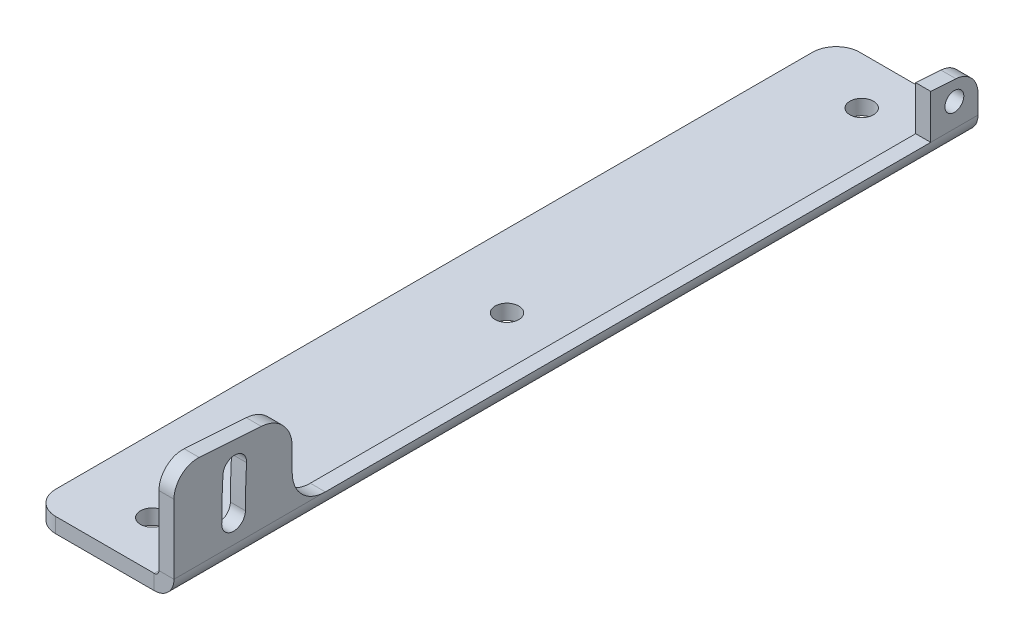
from build123d import *

# Parameters (mm, degrees)
BASE_FLANGE1_DEPTH = 170
FILLET1_R          = 5
SKETCH6_R          = 2
CUT_EXTRUDE1_DEPTH = 178.200451467
SKETCH7_R          = 2.5
CUT_EXTRUDE2_DEPTH = 178.200451467
CUT_EXTRUDE3_DEPTH = 177.690635363
FILLET2_R          = 5
CUT_EXTRUDE4_DEPTH = 175.263907966
FILLET3_R          = 7


# Sheet-metal steps are written as plain solids
with BuildPart() as part:
    # Sketch1 → Base-Flange1 (new body)
    with BuildSketch(Plane.XY):
        with BuildLine():
            Line((0, 40), (0, 4.175))
            ThreePointArc((0, 4.175), (-1.222829189, 1.222829189), (-4.175, 0))
            Line((-4.175, 0), (-30, 0))
            Line((-30, 0), (-30, 3.175))
            Line((-30, 3.175), (-4.175, 3.175))
            ThreePointArc((-4.175, 3.175), (-3.467893219, 3.467893219), (-3.175, 4.175))
            Line((-3.175, 4.175), (-3.175, 40))
            Line((-3.175, 40), (0, 40))
        make_face()
    extrude(amount=BASE_FLANGE1_DEPTH)

    # Fillet1
    fillet1_edges = [part.edges().sort_by_distance(p)[0] for p in [
        (-1.5875, 40, 170),
        (-1.5875, 40, 0),
        (-30, 1.5875, 170),
        (-30, 1.5875, 0),
    ]]
    fillet(fillet1_edges, radius=FILLET1_R)

    # Sketch6 → Cut-Extrude1 (cut, through all)
    with BuildSketch(Plane.ZY):
        with BuildLine():
            ThreePointArc((159.640076561, 18.14476706), (156.999504521, 20.49580498), (154.648466601, 17.85523294))
            ThreePointArc((154.648466601, 17.85523294), (154.837103455, 13.516938304), (154.9, 9.175))
            ThreePointArc((154.9, 9.175), (157.4, 6.675), (159.9, 9.175))
            ThreePointArc((159.9, 9.175), (159.835005505, 13.661766133), (159.640076561, 18.14476706))
        make_face()
        with Locations(Location((5, 9.175, 0), (0, 0, 180))):
            Circle(SKETCH6_R)
    extrude(amount=CUT_EXTRUDE1_DEPTH, mode=Mode.SUBTRACT)

    # Sketch7 → Cut-Extrude2 (cut, through all)
    with BuildSketch(Plane.XZ):
        with Locations(Location((-14.5875, 160, 0), (0, 0, 270))):
            Circle(SKETCH7_R)
        with Locations(Location((-14.5875, 85, 0), (0, 0, 270))):
            Circle(SKETCH7_R)
        with Locations(Location((-14.5875, 10, 0), (0, 0, 270))):
            Circle(SKETCH7_R)
    extrude(amount=-CUT_EXTRUDE2_DEPTH, mode=Mode.SUBTRACT)

    # Sketch8 → Cut-Extrude3 (cut, through all)
    with BuildSketch(Plane.ZY.offset(3.175)):
        with BuildLine():
            Line((0, 12.85080004), (170, 24.175))
            Line((170, 24.175), (170, 35))
            ThreePointArc((170, 35), (168.535533906, 38.535533906), (165, 40))
            Line((165, 40), (5, 40))
            ThreePointArc((5, 40), (1.464466094, 38.535533906), (0, 35))
            Line((0, 35), (0, 12.85080004))
        make_face()
    extrude(amount=-CUT_EXTRUDE3_DEPTH, mode=Mode.SUBTRACT)

    # Fillet2
    fillet2_edges = [part.edges().sort_by_distance(p)[0] for p in [
        (-1.5875, 24.175, 170),
        (-1.5875, 12.85080004, 0),
    ]]
    fillet(fillet2_edges, radius=FILLET2_R)

    # Sketch9 → Cut-Extrude4 (cut, through all)
    with BuildSketch(Plane(origin=(0, 0, 0), x_dir=(0, 0, -1), z_dir=(1, 0, 0))):
        Polygon((-10, 13.51692945), (-145, 22.509676476), (-145, 4.175), (-10, 4.175), align=None)
    extrude(amount=-CUT_EXTRUDE4_DEPTH, mode=Mode.SUBTRACT)

    # Fillet3
    fillet3_edges = [part.edges().sort_by_distance(p)[0] for p in [
        (-1.5875, 4.175, 145),
        (-1.5875, 22.509676476, 145),
    ]]
    fillet(fillet3_edges, radius=FILLET3_R)


solid = part.part
